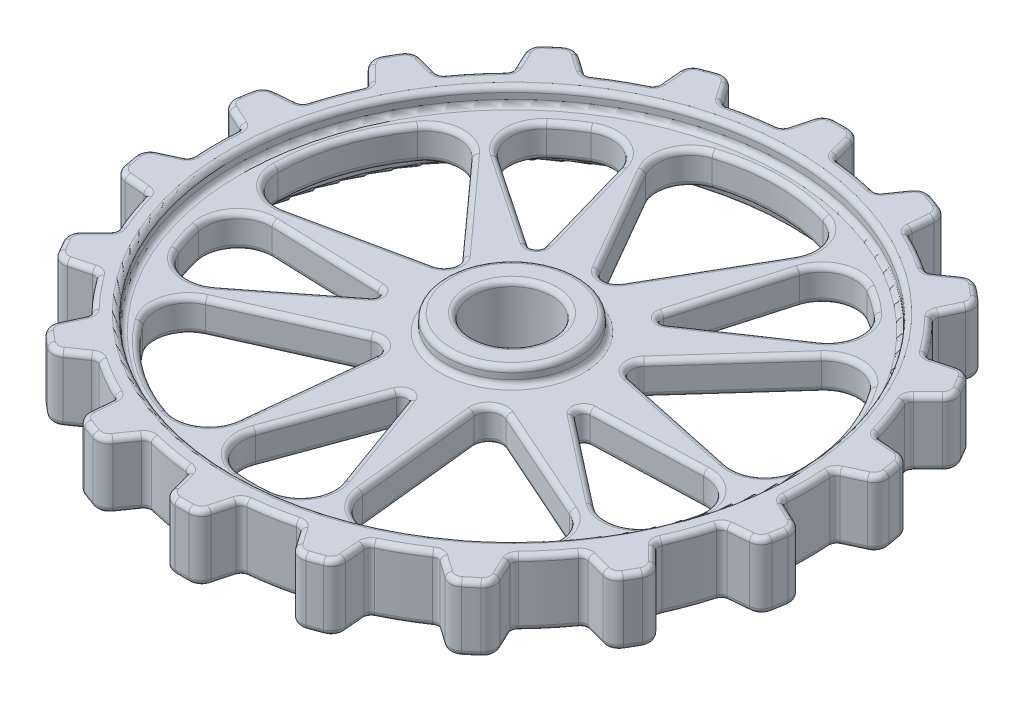
from build123d import *

# Parameters (mm, degrees)
SKETCH_1_W                       = 50
SKETCH_1_H                       = 10
SKETCH_6_W                       = 6
SKETCH_6_H                       = 10
CUT_REVOLVE_START                = -5
CUT_REVOLVE_5_DEPTH              = 10
FILLET_3_R                       = 2
FILLET_4_R                       = 5
PATTERN_CIRCULAR_3_COUNT         = 5
FILLET_3_OF_PATTERN_CIRCULAR_3_R = 2
FILLET_4_OF_PATTERN_CIRCULAR_3_R = 5
CUT_REVOLVE_6_DEPTH              = 10
FILLET_5_R                       = 1
FILLET_6_R                       = 5
PATTERN_CIRCULAR_4_COUNT         = 5
FILLET_5_OF_PATTERN_CIRCULAR_4_R = 1
FILLET_6_OF_PATTERN_CIRCULAR_4_R = 5
CUT_REVOLVE_1_DEPTH              = 10
SKETCH_3_W                       = 10
SKETCH_3_H                       = 10
CUT_REVOLVE_2_ANGLE              = 20
SKETCH_4_W                       = 8
SKETCH_4_H                       = 10
CUT_REVOLVE_3_ANGLE              = 20
FILLET_1_R                       = 1
FILLET_2_R                       = 2
PATTERN_CIRCULAR_2_COUNT         = 18
FILLET_1_OF_PATTERN_CIRCULAR_2_R = 1
FILLET_2_OF_PATTERN_CIRCULAR_2_R = 2
SKETCH_11_W                      = 32
SKETCH_11_H                      = 8
FILLET_7_R                       = 0.8


# Read off the part's stored shape, not the designer's step: Вырез-Повернуть5, Вырез-Повернуть6, Вырез-Повернуть1
with BuildPart() as part:
    # Эскиз1 → Повернуть1 (revolve)
    with BuildSketch(Plane.XY, mode=Mode.PRIVATE) as revolve_1_sk:
        with Locations((25, 0)):
            Rectangle(SKETCH_1_W, SKETCH_1_H)
    revolve(revolve_1_sk.sketch.rotate(Axis((0, -5, 0), (0, 1, 0)), 90), axis=Axis((0, -5, 0), (0, 1, 0)))

    # Эскиз6 → Вырез-Повернуть4 (revolve, cut)
    with BuildSketch(Plane.XY, mode=Mode.PRIVATE) as cut_revolve_4_sk:
        with Locations((3, 0)):
            Rectangle(SKETCH_6_W, SKETCH_6_H)
    revolve(cut_revolve_4_sk.sketch.rotate(Axis((0, 5, 0), (0, -1, 0)), 90), axis=Axis((0, 5, 0), (0, -1, 0)), mode=Mode.SUBTRACT)

    # Вырез-Повернуть5 outline → Вырез-Повернуть5 (cut)
    with BuildSketch(Plane(origin=(0, 0, 0), x_dir=(1, 0, 0), z_dir=(0, 1, 0)).offset(CUT_REVOLVE_START)):
        with BuildLine():
            Line((0, 12), (14, 36.248711306))
            ThreePointArc((14, 36.248711306), (0, 40), (-14, 36.248711306))
            Line((-14, 36.248711306), (0, 12))
        make_face()
    cut_revolve_5 = extrude(amount=CUT_REVOLVE_5_DEPTH, mode=Mode.SUBTRACT)

    # Скругление3
    fillet_3_edges = [part.edges().sort_by_distance(p)[0] for p in [
        (0, 0, -12),
    ]]
    fillet(fillet_3_edges, radius=FILLET_3_R)

    # Скругление4
    fillet_4_edges = [part.edges().sort_by_distance(p)[0] for p in [
        (-14, 0, -36.248711306),
        (14, 0, -36.248711306),
    ]]
    fillet(fillet_4_edges, radius=FILLET_4_R)

    # Круговой массив3: Вырез-Повернуть5 ×5 about axis
    pattern_circular_3_axis = Axis((0, 0, 0), (0, 1, 0))
    for i in range(1, PATTERN_CIRCULAR_3_COUNT):
        add(cut_revolve_5.rotate(pattern_circular_3_axis, i * 360 / PATTERN_CIRCULAR_3_COUNT), mode=Mode.SUBTRACT)

    # Скругление3 of Круговой массив3
    fillet_3_of_pattern_circular_3_edges = [part.edges().sort_by_distance(p)[0] for p in [
        (-11.412678196, 0, -3.708203932),
        (-7.053423028, 0, 9.708203932),
        (7.053423028, 0, 9.708203932),
        (11.412678196, 0, -3.708203932),
    ]]
    fillet(fillet_3_of_pattern_circular_3_edges, radius=FILLET_3_OF_PATTERN_CIRCULAR_3_R)

    # Скругление4 of Круговой массив3
    fillet_4_of_pattern_circular_3_edges = [part.edges().sort_by_distance(p)[0] for p in [
        (-38.800811016, 0, 2.11332341),
        (-30.148335174, 0, -24.516259046),
        (-9.980219999, 0, 37.554817003),
        (-32.632695842, 0, 21.096829939),
        (32.632695842, 0, 21.096829939),
        (9.980219999, 0, 37.554817003),
        (30.148335174, 0, -24.516259046),
        (38.800811016, 0, 2.11332341),
    ]]
    fillet(fillet_4_of_pattern_circular_3_edges, radius=FILLET_4_OF_PATTERN_CIRCULAR_3_R)

    # Вырез-Повернуть6 outline → Вырез-Повернуть6 (cut)
    with BuildSketch(Plane(origin=(0, 0, 0), x_dir=(1, 0, 0), z_dir=(0, 1, 0)).offset(CUT_REVOLVE_START)):
        with BuildLine():
            Line((8.228993532, 11.326237921), (28.954932846, 25.306060508))
            ThreePointArc((28.954932846, 25.306060508), (22.92362484, 31.551662781), (15.119927428, 35.35778032))
            Line((15.119927428, 35.35778032), (8.228993532, 11.326237921))
        make_face()
    cut_revolve_6 = extrude(amount=CUT_REVOLVE_6_DEPTH, mode=Mode.SUBTRACT)

    # Скругление5
    fillet_5_edges = [part.edges().sort_by_distance(p)[0] for p in [
        (8.228993532, 0, -11.326237921),
    ]]
    fillet(fillet_5_edges, radius=FILLET_5_R)

    # Скругление6
    fillet_6_edges = [part.edges().sort_by_distance(p)[0] for p in [
        (15.119927428, 0, -35.35778032),
        (28.954932846, 0, -25.306060508),
    ]]
    fillet(fillet_6_edges, radius=FILLET_6_R)

    # Круговой массив4: Вырез-Повернуть6 ×5 about axis
    pattern_circular_4_axis = Axis((0, 0, 0), (0, 1, 0))
    for i in range(1, PATTERN_CIRCULAR_4_COUNT):
        add(cut_revolve_6.rotate(pattern_circular_4_axis, i * 360 / PATTERN_CIRCULAR_4_COUNT), mode=Mode.SUBTRACT)

    # Скругление5 of Круговой массив4
    fillet_5_of_pattern_circular_4_edges = [part.edges().sort_by_distance(p)[0] for p in [
        (-8.228993532, 0, -11.326237921),
        (-13.314791228, 0, 4.326237921),
        (0, 0, 14),
        (13.314791228, 0, 4.326237921),
    ]]
    fillet(fillet_5_of_pattern_circular_4_edges, radius=FILLET_5_OF_PATTERN_CIRCULAR_4_R)

    # Скругление6 of Круговой массив4
    fillet_6_of_pattern_circular_4_edges = [part.edges().sort_by_distance(p)[0] for p in [
        (-28.954932846, 0, -25.306060509),
        (-15.119927427, 0, -35.35778032),
        (-33.015060069, 0, 19.717774804),
        (-38.299561904, 0, 3.453750504),
        (8.550503583, 0, 37.49231552),
        (-8.550503583, 0, 37.49231552),
        (38.299561904, 0, 3.453750504),
        (33.015060068, 0, 19.717774804),
    ]]
    fillet(fillet_6_of_pattern_circular_4_edges, radius=FILLET_6_OF_PATTERN_CIRCULAR_4_R)

    # Вырез-Повернуть1 outline → Вырез-Повернуть1 (cut)
    with BuildSketch(Plane(origin=(0, 0, 0), x_dir=(1, 0, 0), z_dir=(0, 1, 0)).offset(CUT_REVOLVE_START)):
        with BuildLine():
            ThreePointArc((44.828761414, 3.922008424), (45, 0), (44.828761414, -3.922008424))
            Line((44.828761414, -3.922008424), (49.809734905, -4.357787137))
            ThreePointArc((49.809734905, -4.357787137), (50, 0), (49.809734905, 4.357787137))
            Line((49.809734905, 4.357787137), (44.828761414, 3.922008424))
        make_face()
    cut_revolve_1 = extrude(amount=CUT_REVOLVE_1_DEPTH, mode=Mode.SUBTRACT)

    # Эскиз3 → Вырез-Повернуть2 (revolve, cut)
    with BuildSketch(Plane(origin=(0, 0, 0), x_dir=(0.9961946980917455, 0, -0.08715574274765836), z_dir=(0.08715574274765837, 0, 0.9961946980917457))):
        with Locations((50, 0)):
            Rectangle(SKETCH_3_W, SKETCH_3_H)
    cut_revolve_2 = revolve(axis=Axis((44.828761414, -5, -3.922008424), (0, 1, 0)), revolution_arc=CUT_REVOLVE_2_ANGLE, mode=Mode.SUBTRACT)

    # Эскиз4 → Вырез-Повернуть3 (revolve, cut)
    with BuildSketch(Plane(origin=(0, 0, 0), x_dir=(-0.9961946980917455, 0, -0.08715574274765835), z_dir=(0.08715574274765836, 0, -0.9961946980917457))):
        with Locations((-49, 0)):
            Rectangle(SKETCH_4_W, SKETCH_4_H)
    cut_revolve_3 = revolve(axis=Axis((44.828761414, 5, 3.922008424), (0, -1, 0)), revolution_arc=CUT_REVOLVE_3_ANGLE, mode=Mode.SUBTRACT)

    # Скругление1
    fillet_1_edges = [part.edges().sort_by_distance(p)[0] for p in [
        (44.828761414, 0, -3.922008424),
        (44.828761414, 0, 3.922008424),
    ]]
    fillet(fillet_1_edges, radius=FILLET_1_R)

    # Скругление2
    fillet_2_edges = [part.edges().sort_by_distance(p)[0] for p in [
        (49.61958855, 0, -6.156007806),
        (49.61958855, 0, 6.156007806),
    ]]
    fillet(fillet_2_edges, radius=FILLET_2_R)

    # Круговой массив2: Вырез-Повернуть1, Вырез-Повернуть2, Вырез-Повернуть3 ×18 about axis
    pattern_circular_2_axis = Axis((0, 0, 0), (0, 1, 0))
    add([cut_revolve_1.rotate(pattern_circular_2_axis, i * 360 / PATTERN_CIRCULAR_2_COUNT) for i in range(1, PATTERN_CIRCULAR_2_COUNT)], mode=Mode.SUBTRACT)
    add([cut_revolve_2.rotate(pattern_circular_2_axis, i * 360 / PATTERN_CIRCULAR_2_COUNT) for i in range(1, PATTERN_CIRCULAR_2_COUNT)], mode=Mode.SUBTRACT)
    add([cut_revolve_3.rotate(pattern_circular_2_axis, i * 360 / PATTERN_CIRCULAR_2_COUNT) for i in range(1, PATTERN_CIRCULAR_2_COUNT)], mode=Mode.SUBTRACT)

    # Скругление1 of Круговой массив2
    fillet_1_of_pattern_circular_2_edges = [part.edges().sort_by_distance(p)[0] for p in [
        (40.783850416, 0, -19.017821779),
        (43.466662183, 0, -11.646857029),
        (31.819805153, 0, -31.819805154),
        (36.861841993, 0, -25.810939635),
        (19.017821778, 0, -40.783850417),
        (25.810939636, 0, -36.861841993),
        (3.922008423, 0, -44.828761414),
        (11.64685703, 0, -43.466662183),
        (-11.64685703, 0, -43.466662183),
        (-3.922008423, 0, -44.828761414),
        (-25.810939636, 0, -36.861841993),
        (-19.017821778, 0, -40.783850417),
        (-36.861841993, 0, -25.810939635),
        (-31.819805153, 0, -31.819805154),
        (-43.466662183, 0, -11.646857029),
        (-40.783850416, 0, -19.017821779),
        (-44.828761414, 0, 3.922008424),
        (-44.828761414, 0, -3.922008424),
        (-40.783850416, 0, 19.017821779),
        (-43.466662183, 0, 11.646857029),
        (-31.819805153, 0, 31.819805154),
        (-36.861841993, 0, 25.810939635),
        (-19.017821778, 0, 40.783850417),
        (-25.810939636, 0, 36.861841993),
        (-3.922008423, 0, 44.828761414),
        (-11.64685703, 0, 43.466662183),
        (11.64685703, 0, 43.466662183),
        (3.922008423, 0, 44.828761414),
        (25.810939636, 0, 36.861841993),
        (19.017821778, 0, 40.783850417),
        (36.861841993, 0, 25.810939635),
        (31.819805153, 0, 31.819805154),
        (43.466662183, 0, 11.646857029),
        (40.783850416, 0, 19.017821779),
    ]]
    fillet(fillet_1_of_pattern_circular_2_edges, radius=FILLET_1_OF_PATTERN_CIRCULAR_2_R)

    # Скругление2 of Круговой массив2
    fillet_2_of_pattern_circular_2_edges = [part.edges().sort_by_distance(p)[0] for p in [
        (44.521682535, 0, -22.755653897),
        (48.732639879, 0, -11.186143679),
        (34.053804536, 0, -36.610632289),
        (41.967815622, 0, -27.179081146),
        (19.478535129, 0, -46.049828113),
        (30.141053421, 0, -39.893820307),
        (2.553866913, 0, -49.934735043),
        (14.678835343, 0, -47.796775968),
        (-14.678835343, 0, -47.796775968),
        (-2.553866913, 0, -49.934735043),
        (-30.141053421, 0, -39.893820307),
        (-19.478535129, 0, -46.049828113),
        (-41.967815622, 0, -27.179081146),
        (-34.053804536, 0, -36.610632289),
        (-48.732639879, 0, -11.186143679),
        (-44.521682535, 0, -22.755653897),
        (-49.61958855, 0, 6.156007806),
        (-49.61958855, 0, -6.156007806),
        (-44.521682535, 0, 22.755653897),
        (-48.732639879, 0, 11.186143679),
        (-34.053804536, 0, 36.610632289),
        (-41.967815622, 0, 27.179081146),
        (-19.478535129, 0, 46.049828113),
        (-30.141053421, 0, 39.893820307),
        (-2.553866913, 0, 49.934735043),
        (-14.678835343, 0, 47.796775968),
        (14.678835343, 0, 47.796775968),
        (2.553866913, 0, 49.934735043),
        (30.141053421, 0, 39.893820307),
        (19.478535129, 0, 46.049828113),
        (41.967815622, 0, 27.179081146),
        (34.053804536, 0, 36.610632289),
        (48.732639879, 0, 11.186143679),
        (44.521682535, 0, 22.755653897),
    ]]
    fillet(fillet_2_of_pattern_circular_2_edges, radius=FILLET_2_OF_PATTERN_CIRCULAR_2_R)

    # Эскиз11 → Вырез-Повернуть7 (revolve, cut)
    with BuildSketch(Plane.XY, mode=Mode.PRIVATE) as cut_revolve_7_sk:
        with Locations((-26, 6.5)):
            Rectangle(SKETCH_11_W, SKETCH_11_H)
    cut_revolve_7 = revolve(cut_revolve_7_sk.sketch.rotate(Axis((0, -5, 0), (0, -1, 0)), 270), axis=Axis((0, -5, 0), (0, -1, 0)), mode=Mode.SUBTRACT)

    # Зеркальное отражение1: Вырез-Повернуть7 across plane
    add(cut_revolve_7.mirror(Plane.ZX), mode=Mode.SUBTRACT)

    # Скругление7
    fillet_7_edges = [part.edges().sort_by_distance(p)[0] for p in [
        (0, -5, -6),
        (0, 5, -6),
        (45.70940873, -5, 11.450642132),
        (42.286167935, -5, 15.39090645),
        (42.286167935, 5, 15.39090645),
        (42.375769441, 5, 20.609740802),
        (43.608757279, -5, 11.811593562),
        (43.608757279, 5, 11.811593562),
        (40.998592177, -5, 18.98296324),
        (40.998592177, 5, 18.98296324),
        (39.036443821, -5, 26.393622439),
        (34.47199994, -5, 28.925442436),
        (34.47199994, 5, 28.925442436),
        (32.77125134, 5, 33.860188086),
        (36.939024493, -5, 26.014340725),
        (36.939024493, 5, 26.014340725),
        (32.033518723, -5, 31.86049485),
        (32.033518723, 5, 31.86049485),
        (27.65510767, -5, 38.153142353),
        (22.5, -5, 38.97114317),
        (22.5, 5, 38.97114317),
        (19.214036676, 5, 43.026596963),
        (25.813900192, -5, 37.079374465),
        (25.813900192, 5, 37.079374465),
        (19.204730147, -5, 40.89518057),
        (19.204730147, 5, 40.89518057),
        (12.938157389, -5, 45.310830218),
        (7.814167995, -5, 44.316348886),
        (7.814167995, 5, 44.316348886),
        (3.33932562, 5, 47.003363242),
        (11.575238555, -5, 43.672088412),
        (11.575238555, 5, 43.672088412),
        (4.059567684, -5, 44.997303965),
        (4.059567684, 5, 44.997303965),
        (-3.33932562, -5, 47.003363242),
        (-7.814167995, -5, 44.316348886),
        (-7.814167995, 5, 44.316348886),
        (-12.938157389, 5, 45.310830218),
        (-4.059567684, -5, 44.997303965),
        (-4.059567684, 5, 44.997303965),
        (-11.575238555, -5, 43.672088412),
        (-11.575238555, 5, 43.672088412),
        (-19.214036676, -5, 43.026596963),
        (-22.5, -5, 38.97114317),
        (-22.5, 5, 38.97114317),
        (-27.65510767, 5, 38.153142353),
        (-19.204730147, -5, 40.89518057),
        (-19.204730147, 5, 40.89518057),
        (-25.813900192, -5, 37.079374465),
        (-25.813900192, 5, 37.079374465),
        (-32.77125134, -5, 33.860188086),
        (-34.47199994, -5, 28.925442436),
        (-34.47199994, 5, 28.925442436),
        (-39.036443821, 5, 26.393622439),
        (-32.033518723, -5, 31.86049485),
        (-32.033518723, 5, 31.86049485),
        (-36.939024493, -5, 26.014340725),
        (-36.939024493, 5, 26.014340725),
        (-42.375769441, -5, 20.609740802),
        (-42.286167935, -5, 15.39090645),
        (-42.286167935, 5, 15.39090645),
        (-45.70940873, 5, 11.450642132),
        (-40.998592177, -5, 18.98296324),
        (-40.998592177, 5, 18.98296324),
        (-43.608757279, -5, 11.811593562),
        (-43.608757279, 5, 11.811593562),
        (-46.869144347, -5, 4.873454611),
        (-45, -5, 0),
        (-45, 5, 0),
        (-46.869144347, 5, -4.873454611),
        (-45.01863034, -5, 3.815806105),
        (-45.01863034, 5, 3.815806105),
        (-45.01863034, -5, -3.815806105),
        (-45.01863034, 5, -3.815806105),
        (-45.70940873, -5, -11.450642132),
        (-42.286167935, -5, -15.39090645),
        (-42.286167935, 5, -15.39090645),
        (-42.375769441, 5, -20.609740802),
        (-43.608757279, -5, -11.811593562),
        (-43.608757279, 5, -11.811593562),
        (-40.998592177, -5, -18.98296324),
        (-40.998592177, 5, -18.98296324),
        (-39.036443821, -5, -26.393622439),
        (-34.47199994, -5, -28.925442436),
        (-34.47199994, 5, -28.925442436),
        (-32.77125134, 5, -33.860188086),
        (-36.939024493, -5, -26.014340725),
        (-36.939024493, 5, -26.014340725),
        (-32.033518723, -5, -31.86049485),
        (-32.033518723, 5, -31.86049485),
        (-27.65510767, -5, -38.153142353),
        (-22.5, -5, -38.97114317),
        (-22.5, 5, -38.97114317),
        (-19.214036676, 5, -43.026596963),
        (-25.813900192, -5, -37.079374465),
        (-25.813900192, 5, -37.079374465),
        (-19.204730147, -5, -40.89518057),
        (-19.204730147, 5, -40.89518057),
        (-12.938157389, -5, -45.310830218),
        (-7.814167995, -5, -44.316348886),
        (-7.814167995, 5, -44.316348886),
        (-3.33932562, 5, -47.003363242),
        (-11.575238555, -5, -43.672088412),
        (-11.575238555, 5, -43.672088412),
        (-4.059567684, -5, -44.997303965),
        (-4.059567684, 5, -44.997303965),
        (3.33932562, -5, -47.003363242),
        (7.814167995, -5, -44.316348886),
        (7.814167995, 5, -44.316348886),
        (12.938157389, 5, -45.310830218),
        (4.059567684, -5, -44.997303965),
        (4.059567684, 5, -44.997303965),
        (11.575238555, -5, -43.672088412),
        (11.575238555, 5, -43.672088412),
        (19.214036676, -5, -43.026596963),
        (22.5, -5, -38.97114317),
        (22.5, 5, -38.97114317),
        (27.65510767, 5, -38.153142353),
        (19.204730147, -5, -40.89518057),
        (19.204730147, 5, -40.89518057),
        (25.813900192, -5, -37.079374465),
        (25.813900192, 5, -37.079374465),
        (32.77125134, -5, -33.860188086),
        (34.47199994, -5, -28.925442436),
        (34.47199994, 5, -28.925442436),
        (39.036443821, 5, -26.393622439),
        (32.033518723, -5, -31.86049485),
        (32.033518723, 5, -31.86049485),
        (36.939024493, -5, -26.014340725),
        (36.939024493, 5, -26.014340725),
        (42.375769441, -5, -20.609740802),
        (42.286167935, -5, -15.39090645),
        (42.286167935, 5, -15.39090645),
        (45.70940873, 5, -11.450642132),
        (40.998592177, -5, -18.98296324),
        (40.998592177, 5, -18.98296324),
        (43.608757279, -5, -11.811593562),
        (43.608757279, 5, -11.811593562),
        (45.70940873, 5, 11.450642132),
        (43.301270189, 5, 25),
        (44.042435556, 5, 22.842996544),
        (48.421658165, 5, 10.811181309),
        (42.375769441, -5, 20.609740802),
        (43.301270189, -5, 25),
        (44.042435556, -5, 22.842996544),
        (48.421658165, -5, 10.811181309),
        (39.036443821, 5, 26.393622439),
        (32.139380484, 5, 38.302222156),
        (33.573586742, 5, 36.52879541),
        (41.803833083, 5, 26.720369764),
        (32.77125134, -5, 33.860188086),
        (32.139380484, -5, 38.302222156),
        (33.573586742, -5, 36.52879541),
        (41.803833083, -5, 26.720369764),
        (27.65510767, 5, 38.153142353),
        (17.101007166, 5, 46.984631039),
        (19.055267873, 5, 45.808682442),
        (30.143848773, 5, 39.406687275),
        (19.214036676, -5, 43.026596963),
        (17.101007166, -5, 46.984631039),
        (19.055267873, -5, 45.808682442),
        (30.143848773, -5, 39.406687275),
        (12.938157389, 5, 45.310830218),
        (0, 5, 50),
        (2.238602473, 5, 49.563366308),
        (14.848071424, 5, 47.339976719),
        (3.33932562, -5, 47.003363242),
        (0, -5, 50),
        (2.238602473, -5, 49.563366308),
        (14.848071424, -5, 47.339976719),
        (-3.33932562, 5, 47.003363242),
        (-17.101007166, 5, 46.984631039),
        (-14.848071424, 5, 47.339976719),
        (-2.238602473, 5, 49.563366308),
        (-12.938157389, -5, 45.310830218),
        (-17.101007166, -5, 46.984631039),
        (-14.848071424, -5, 47.339976719),
        (-2.238602473, -5, 49.563366308),
        (-19.214036676, 5, 43.026596963),
        (-32.139380484, 5, 38.302222156),
        (-30.143848773, 5, 39.406687275),
        (-19.055267873, 5, 45.808682442),
        (-27.65510767, -5, 38.153142353),
        (-32.139380484, -5, 38.302222156),
        (-30.143848773, -5, 39.406687275),
        (-19.055267873, -5, 45.808682442),
        (-32.77125134, 5, 33.860188086),
        (-43.301270189, 5, 25),
        (-41.803833083, 5, 26.720369764),
        (-33.573586742, 5, 36.52879541),
        (-39.036443821, -5, 26.393622439),
        (-43.301270189, -5, 25),
        (-41.803833083, -5, 26.720369764),
        (-33.573586742, -5, 36.52879541),
        (-42.375769441, 5, 20.609740802),
        (-49.240387651, 5, 8.682408883),
        (-48.421658165, 5, 10.811181309),
        (-44.042435556, 5, 22.842996544),
        (-45.70940873, -5, 11.450642132),
        (-49.240387651, -5, 8.682408883),
        (-48.421658165, -5, 10.811181309),
        (-44.042435556, -5, 22.842996544),
        (-46.869144347, 5, 4.873454611),
        (-49.240387651, 5, -8.682408883),
        (-49.199116645, 5, -6.401995167),
        (-49.199116645, 5, 6.401995167),
        (-46.869144347, -5, -4.873454611),
        (-49.240387651, -5, -8.682408883),
        (-49.199116645, -5, -6.401995167),
        (-49.199116645, -5, 6.401995167),
        (-45.70940873, 5, -11.450642132),
        (-43.301270189, 5, -25),
        (-44.042435556, 5, -22.842996544),
        (-48.421658165, 5, -10.811181309),
        (-42.375769441, -5, -20.609740802),
        (-43.301270189, -5, -25),
        (-44.042435556, -5, -22.842996544),
        (-48.421658165, -5, -10.811181309),
        (-39.036443821, 5, -26.393622439),
        (-32.139380484, 5, -38.302222156),
        (-33.573586742, 5, -36.52879541),
        (-41.803833083, 5, -26.720369764),
        (-32.77125134, -5, -33.860188086),
        (-32.139380484, -5, -38.302222156),
        (-33.573586742, -5, -36.52879541),
        (-41.803833083, -5, -26.720369764),
        (-27.65510767, 5, -38.153142353),
        (-17.101007166, 5, -46.984631039),
        (-19.055267873, 5, -45.808682442),
        (-30.143848773, 5, -39.406687275),
        (-19.214036676, -5, -43.026596963),
        (-17.101007166, -5, -46.984631039),
        (-19.055267873, -5, -45.808682442),
        (-30.143848773, -5, -39.406687275),
        (-12.938157389, 5, -45.310830218),
        (0, 5, -50),
        (-2.238602473, 5, -49.563366308),
        (-14.848071424, 5, -47.339976719),
        (-3.33932562, -5, -47.003363242),
        (0, -5, -50),
        (-2.238602473, -5, -49.563366308),
        (-14.848071424, -5, -47.339976719),
        (3.33932562, 5, -47.003363242),
        (17.101007166, 5, -46.984631039),
        (14.848071424, 5, -47.339976719),
        (2.238602473, 5, -49.563366308),
        (12.938157389, -5, -45.310830218),
        (17.101007166, -5, -46.984631039),
        (14.848071424, -5, -47.339976719),
        (2.238602473, -5, -49.563366308),
        (19.214036676, 5, -43.026596963),
        (32.139380484, 5, -38.302222156),
        (30.143848773, 5, -39.406687275),
        (19.055267873, 5, -45.808682442),
        (27.65510767, -5, -38.153142353),
        (32.139380484, -5, -38.302222156),
        (30.143848773, -5, -39.406687275),
        (19.055267873, -5, -45.808682442),
        (32.77125134, 5, -33.860188086),
        (43.301270189, 5, -25),
        (41.803833083, 5, -26.720369764),
        (33.573586742, 5, -36.52879541),
        (39.036443821, -5, -26.393622439),
        (43.301270189, -5, -25),
        (41.803833083, -5, -26.720369764),
        (33.573586742, -5, -36.52879541),
        (42.375769441, 5, -20.609740802),
        (49.240387651, 5, -8.682408883),
        (48.421658165, 5, -10.811181309),
        (44.042435556, 5, -22.842996544),
        (45.70940873, -5, -11.450642132),
        (49.240387651, -5, -8.682408883),
        (48.421658165, -5, -10.811181309),
        (44.042435556, -5, -22.842996544),
        (-26.47650292, 2.5, -25.972155042),
        (0, 5, -10),
        (0, 5, -42),
        (13.314791228, 2.5, -4.326237921),
        (24.086559124, 2.5, -1.014287379),
        (37.577009484, 2.5, -0.060915358),
        (30.436244419, 2.5, -22.03793044),
        (-8.228993532, 2.5, 11.326237921),
        (-18.890252504, 2.5, 14.978299959),
        (-30.364634121, 2.5, 22.13649356),
        (-11.669868477, 2.5, 35.719035851),
        (9.359777387, 2.5, -12.882628375),
        (17.394996317, 2.5, -17.508784865),
        (26.47650292, 2.5, -25.972155041),
        (16.519297941, 2.5, -33.206487919),
        (0, 2.5, 15.9238044),
        (-3.781442108, 2.5, 24.389426806),
        (-6.15389111, 2.5, 36.574412758),
        (6.15389111, 2.5, 36.574412758),
        (-9.359777387, 2.5, -12.882628375),
        (-11.276494459, 2.5, -21.954136673),
        (-16.51929794, 2.5, -33.206487919),
        (0, 2.5, -10),
        (-15.144437939, 2.5, 4.920726175),
        (-24.364253167, 2.5, 3.940382208),
        (-36.685990518, 2.5, 5.44941686),
        (-32.882676649, 2.5, 17.154813342),
        (15.144437939, 2.5, 4.920726175),
        (22.027193418, 2.5, 11.133112524),
        (32.882676648, 2.5, 17.154813343),
        (36.685990518, 2.5, 5.449416861),
        (-13.314791228, 2.5, -4.326237921),
        (-20.082618831, 2.5, -13.337148505),
        (-30.436244419, 2.5, -22.03793044),
        (-37.577009484, 2.5, -0.060915358),
        (8.228993532, 2.5, 11.326237921),
        (8.407800727, 2.5, 22.594246973),
        (11.669868477, 2.5, 35.719035851),
        (30.364634121, 2.5, 22.13649356),
        (0, 2.5, -14),
        (6.478511484, 2.5, -23.221111048),
        (11.55400058, 2.5, -35.756683613),
        (-11.55400058, 2.5, -35.756683613),
        (-6.478511484, 2.5, -23.221111048),
        (0, 2.5, -40),
        (20.082618831, 2.5, -13.337148505),
        (38.042260652, 2.5, -12.360679775),
        (18.890252504, 2.5, 14.978299959),
        (23.511410092, 2.5, 32.360679775),
        (-8.407800727, 2.5, 22.594246973),
        (-23.511410092, 2.5, 32.360679775),
        (-24.086559124, 2.5, -1.014287379),
        (-38.042260652, 2.5, -12.360679775),
        (11.27649446, 2.5, -21.954136673),
        (22.92362484, 2.5, -31.551662781),
        (24.364253167, 2.5, 3.940382208),
        (37.091204136, 2.5, 12.051662781),
        (3.781442108, 2.5, 24.389426806),
        (0, 2.5, 39.000000001),
        (-22.027193418, 2.5, 11.133112524),
        (-37.091204136, 2.5, 12.05166278),
        (-17.394996317, 2.5, -17.508784865),
        (-22.92362484, 2.5, -31.551662781),
        (0, 2.5, -42),
        (-26.47650292, -2.5, -25.972155042),
        (0, -5, -10),
        (0, -5, -42),
        (37.577009484, -2.5, -0.060915358),
        (24.086559124, -2.5, -1.014287379),
        (13.314791228, -2.5, -4.326237921),
        (30.436244419, -2.5, -22.03793044),
        (-30.364634121, -2.5, 22.13649356),
        (-18.890252504, -2.5, 14.978299959),
        (-8.228993532, -2.5, 11.326237921),
        (-11.669868477, -2.5, 35.719035851),
        (26.47650292, -2.5, -25.972155041),
        (17.394996317, -2.5, -17.508784865),
        (9.359777387, -2.5, -12.882628375),
        (16.519297941, -2.5, -33.206487919),
        (-6.15389111, -2.5, 36.574412758),
        (-3.781442108, -2.5, 24.389426806),
        (0, -2.5, 15.9238044),
        (6.15389111, -2.5, 36.574412758),
        (-16.51929794, -2.5, -33.206487919),
        (-11.276494459, -2.5, -21.954136673),
        (-9.359777387, -2.5, -12.882628375),
        (0, -2.5, -42),
        (-36.685990518, -2.5, 5.44941686),
        (-24.364253167, -2.5, 3.940382208),
        (-15.144437939, -2.5, 4.920726175),
        (-32.882676649, -2.5, 17.154813342),
        (32.882676648, -2.5, 17.154813343),
        (22.027193418, -2.5, 11.133112524),
        (15.144437939, -2.5, 4.920726175),
        (36.685990518, -2.5, 5.449416861),
        (-30.436244419, -2.5, -22.03793044),
        (-20.082618831, -2.5, -13.337148505),
        (-13.314791228, -2.5, -4.326237921),
        (-37.577009484, -2.5, -0.060915358),
        (11.669868477, -2.5, 35.719035851),
        (8.407800727, -2.5, 22.594246973),
        (8.228993532, -2.5, 11.326237921),
        (30.364634121, -2.5, 22.13649356),
        (11.55400058, -2.5, -35.756683613),
        (6.478511484, -2.5, -23.221111048),
        (0, -2.5, -14),
        (-11.55400058, -2.5, -35.756683613),
        (0, -2.5, -40),
        (-6.478511484, -2.5, -23.221111048),
        (38.042260652, -2.5, -12.360679775),
        (20.082618831, -2.5, -13.337148505),
        (23.511410092, -2.5, 32.360679775),
        (18.890252504, -2.5, 14.978299959),
        (-23.511410092, -2.5, 32.360679775),
        (-8.407800727, -2.5, 22.594246973),
        (-38.042260652, -2.5, -12.360679775),
        (-24.086559124, -2.5, -1.014287379),
        (22.92362484, -2.5, -31.551662781),
        (11.27649446, -2.5, -21.954136673),
        (37.091204136, -2.5, 12.051662781),
        (24.364253167, -2.5, 3.940382208),
        (0, -2.5, 39.000000001),
        (3.781442108, -2.5, 24.389426806),
        (-37.091204136, -2.5, 12.05166278),
        (-22.027193418, -2.5, 11.133112524),
        (0, -2.5, -10),
    ]]
    fillet(fillet_7_edges, radius=FILLET_7_R)


solid = part.part
